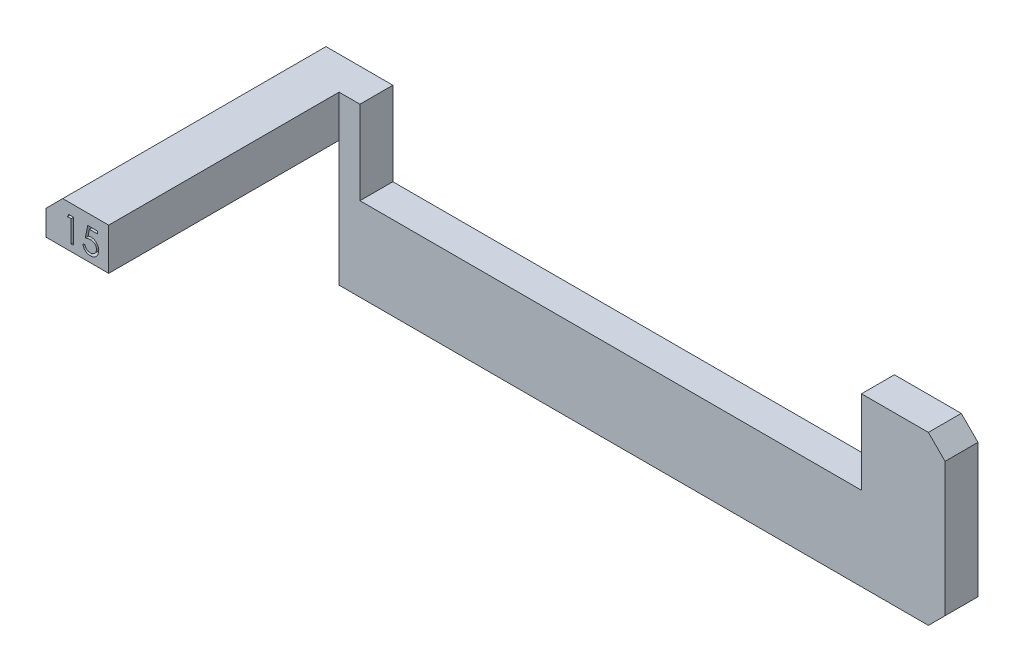
from build123d import *

# Parameters (mm, degrees)
BOSS_EXTRUDE1_DEPTH = 5
SKETCH2_W           = 9.525
SKETCH2_H           = 6.35
BOSS_EXTRUDE2_DEPTH = 35
CUT_EXTRUDE1_DEPTH  = 2
CHAMFER1_SIZE       = 2.54
SKETCH4_W           = 9.525
SKETCH4_H           = 19.05
CUT_EXTRUDE2_DEPTH  = 111.420650389


with BuildPart() as part:
    # Sketch1 → Boss-Extrude1 (new body)
    with BuildSketch(Plane.XY):
        Polygon((-101.6, 0), (0, 0), (0, 25.4), (-12.7, 25.4), (-12.7, 12.7), (-88.9, 12.7), (-88.9, 25.4), (-101.6, 25.4), align=None)
    extrude(amount=BOSS_EXTRUDE1_DEPTH)

    # Sketch2 → Boss-Extrude2 (add)
    with BuildSketch(Plane.XY.offset(5)):
        with Locations((-96.8375, 22.225)):
            Rectangle(SKETCH2_W, SKETCH2_H)
    extrude(amount=BOSS_EXTRUDE2_DEPTH)

    # Sketch3 → Cut-Extrude1 (cut)
    with BuildSketch(Plane.XY.offset(40)):
        Polygon((-98.130248231, 23.770166667), (-97.445363248, 23.770166667), (-97.445363248, 20.066), (-97.777788462, 20.066), (-97.777788462, 23.390252137), (-98.347660256, 23.390252137), align=None)
        with BuildLine():
            Line((-93.741196581, 23.770166667), (-93.741196581, 23.390252137))
            Line((-93.741196581, 23.390252137), (-95.001147503, 23.390252137))
            Line((-95.001147503, 23.390252137), (-95.200751035, 22.415979133))
            add(Edge.make_bspline(
                [(-95.200751035, 22.415979133), (-95.161533568, 22.426806171), (-95.085555928, 22.447781844), (-94.973415075, 22.471071284), (-94.866954993, 22.485110546), (-94.797871893, 22.487027516), (-94.764442942, 22.487955128)],
                knots=[0, 0, 0, 0, 1.100273476, 2.13160584, 3.095893838, 4, 4, 4, 4], degree=3))
            add(Edge.make_bspline(
                [(-94.764442942, 22.487955128), (-94.723079318, 22.487059846), (-94.641748097, 22.485299498), (-94.522750211, 22.468395958), (-94.409156233, 22.441789548), (-94.301203724, 22.404620329), (-94.198692975, 22.357090861), (-94.102567139, 22.297718425), (-94.011383348, 22.228362316), (-93.926777436, 22.148622178), (-93.850022543, 22.060863467), (-93.782536871, 21.96650472), (-93.725214796, 21.866462944), (-93.679112997, 21.7597823), (-93.642299577, 21.647642196), (-93.617797049, 21.528862713), (-93.601481032, 21.404563453), (-93.599658173, 21.319574449), (-93.598728632, 21.276235544)],
                knots=[0, 0, 0, 0, 1.052922333, 2.070308379, 3.05430497, 4.020497103, 4.973039431, 5.925935799, 6.892292201, 7.88610001, 8.88166317, 9.857072816, 10.836096531, 11.812156883, 12.81219415, 13.836441305, 14.89672472, 16, 16, 16, 16], degree=3))
            add(Edge.make_bspline(
                [(-93.598728632, 21.276235544), (-93.599432504, 21.246049527), (-93.600830734, 21.186085432), (-93.60794124, 21.097032819), (-93.621631539, 21.009865488), (-93.64001238, 20.924571873), (-93.663869773, 20.841313454), (-93.692750688, 20.75985192), (-93.728094817, 20.680694295), (-93.766863023, 20.603091585), (-93.810515545, 20.528798165), (-93.858964466, 20.459319654), (-93.910151277, 20.39361379), (-93.96522841, 20.332385256), (-94.024707797, 20.276036395), (-94.087869095, 20.224232797), (-94.154208306, 20.176098389), (-94.224751771, 20.133587049), (-94.297927565, 20.094467921), (-94.374792428, 20.06237551), (-94.453596669, 20.033683535), (-94.535474496, 20.010813451), (-94.620240448, 19.992893165), (-94.708034252, 19.980721696), (-94.798395461, 19.971856633), (-94.859646516, 19.971301688), (-94.890586438, 19.971021368)],
                knots=[0, 0, 0, 0, 1.056347294, 2.098418968, 3.122841568, 4.141288669, 5.149314143, 6.15115421, 7.162517403, 8.180376062, 9.185164535, 10.17417709, 11.141909838, 12.097768115, 13.052685741, 14.0056014, 14.954263652, 15.917497458, 16.885230207, 17.854509472, 18.828990115, 19.81800267, 20.826176721, 21.857883937, 22.917946725, 24, 24, 24, 24], degree=3))
            add(Edge.make_bspline(
                [(-94.890586438, 19.971021368), (-94.927494946, 19.971752504), (-95.000108075, 19.97319093), (-95.106492342, 19.988238827), (-95.208848633, 20.009790638), (-95.30635299, 20.042214024), (-95.399879244, 20.082840577), (-95.488168287, 20.134186859), (-95.573476067, 20.192373077), (-95.652334639, 20.261038117), (-95.725524859, 20.336090547), (-95.791042581, 20.417537384), (-95.849392283, 20.504034377), (-95.899639565, 20.59600159), (-95.942499971, 20.693197369), (-95.976170834, 20.795985878), (-96.003347093, 20.903830049), (-96.014844213, 20.978075847), (-96.020683761, 21.015786325)],
                knots=[0, 0, 0, 0, 1.0467383, 2.05933395, 3.04377827, 4.011590433, 4.970194871, 5.932262533, 6.905835911, 7.896367577, 8.894135286, 9.877477877, 10.858688626, 11.851381753, 12.8477658, 13.868841284, 14.917554742, 16, 16, 16, 16], degree=3))
            Line((-96.020683761, 21.015786325), (-95.688258547, 21.015786325))
            add(Edge.make_bspline(
                [(-95.688258547, 21.015786325), (-95.680079157, 20.980462913), (-95.664357916, 20.912569353), (-95.629850165, 20.81718035), (-95.58765878, 20.732175838), (-95.537489178, 20.656431363), (-95.477640396, 20.590381841), (-95.40934675, 20.53152045), (-95.332778743, 20.478418438), (-95.247695908, 20.43415601), (-95.157935399, 20.396406579), (-95.063990102, 20.371269368), (-94.968418002, 20.353594257), (-94.903776727, 20.351824977), (-94.871293904, 20.350935897)],
                knots=[0, 0, 0, 0, 1.136247022, 2.183929868, 3.172523383, 4.106158343, 5.02341133, 5.958108904, 6.928429099, 7.938127109, 8.96079061, 9.975095812, 10.982467395, 12, 12, 12, 12], degree=3))
            add(Edge.make_bspline(
                [(-94.871293904, 20.350935897), (-94.839587883, 20.351804554), (-94.77715847, 20.353514946), (-94.685283086, 20.366679567), (-94.596581127, 20.386954663), (-94.511927841, 20.417296927), (-94.429841878, 20.454174254), (-94.352399638, 20.501497709), (-94.27736076, 20.555959562), (-94.207057652, 20.618355329), (-94.142669235, 20.687114922), (-94.08577734, 20.760645163), (-94.03838844, 20.839085493), (-93.998453174, 20.921077913), (-93.968128433, 21.007521052), (-93.946495061, 21.098009796), (-93.933791824, 21.19276765), (-93.932044325, 21.257399336), (-93.931153846, 21.290333934)],
                knots=[0, 0, 0, 0, 1.027316725, 2.022795036, 3.002884548, 3.971462791, 4.93288096, 5.914575861, 6.907176829, 7.935150275, 8.956128384, 9.956726525, 10.942570165, 11.921478529, 12.907843606, 13.90538589, 14.932640048, 16, 16, 16, 16], degree=3))
            add(Edge.make_bspline(
                [(-93.931153846, 21.290333934), (-93.931850737, 21.320047438), (-93.933214801, 21.378207394), (-93.944359655, 21.463296554), (-93.963745117, 21.543807191), (-93.990652057, 21.620128088), (-94.024814536, 21.692331231), (-94.066561883, 21.760491137), (-94.116677563, 21.823709444), (-94.173924811, 21.882015729), (-94.236639571, 21.935826555), (-94.305900866, 21.981699047), (-94.380259288, 22.020290026), (-94.458818948, 22.053593658), (-94.543448465, 22.07751278), (-94.632471901, 22.095470459), (-94.726850584, 22.105858384), (-94.791377895, 22.107299716), (-94.824546608, 22.108040598)],
                knots=[0, 0, 0, 0, 1.045622112, 2.046656509, 3.013763289, 3.955457236, 4.890082067, 5.820317437, 6.762574623, 7.722996705, 8.69280354, 9.665887285, 10.63943826, 11.638615906, 12.663482002, 13.728887084, 14.832589034, 16, 16, 16, 16], degree=3))
            add(Edge.make_bspline(
                [(-94.824546608, 22.108040598), (-94.853258058, 22.107426139), (-94.912539917, 22.106157437), (-95.003474909, 22.096816062), (-95.099033649, 22.081746142), (-95.198849823, 22.061017363), (-95.303223194, 22.03389114), (-95.411933502, 22.00138496), (-95.525209317, 21.962520845), (-95.601533909, 21.933170919), (-95.640769231, 21.918083333)],
                knots=[0, 0, 0, 0, 0.817624296, 1.688186739, 2.600797293, 3.572016777, 4.590301741, 5.671205678, 6.80286297, 8, 8, 8, 8], degree=3))
            Line((-95.640769231, 21.918083333), (-95.260854701, 23.770166667))
            Line((-95.260854701, 23.770166667), (-93.741196581, 23.770166667))
        make_face()
    extrude(amount=-CUT_EXTRUDE1_DEPTH, mode=Mode.SUBTRACT)

    # Chamfer1
    chamfer1_edges = [part.edges().sort_by_distance(p)[0] for p in [
        (0, 0, 2.5),
        (-101.6, 0, 2.5),
        (0, 25.4, 2.5),
        (-101.6, 25.4, 20),
    ]]
    chamfer(chamfer1_edges, length=CHAMFER1_SIZE)

    # Sketch4 → Cut-Extrude2 (cut, through all)
    with BuildSketch(Plane.XY.offset(5)):
        with Locations((-96.8375, 9.525)):
            Rectangle(SKETCH4_W, SKETCH4_H)
    extrude(amount=-CUT_EXTRUDE2_DEPTH, mode=Mode.SUBTRACT)


solid = part.part
